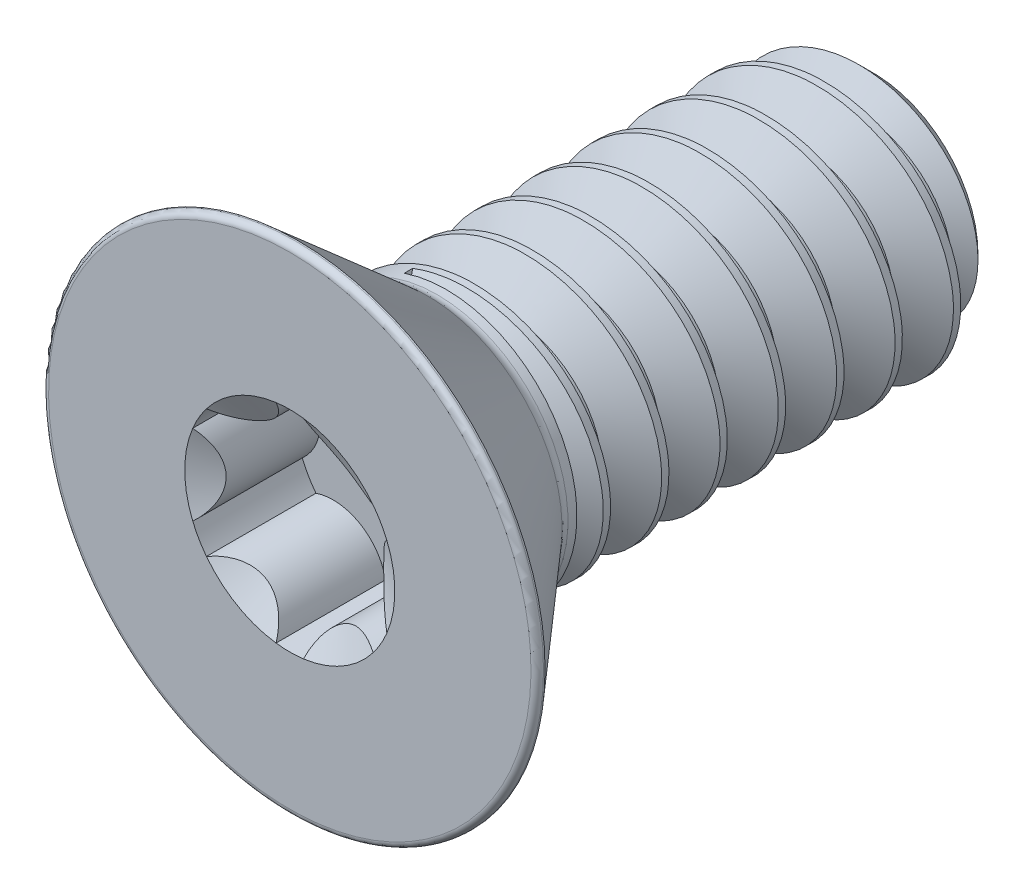
from build123d import *

# Parameters (mm, degrees)
CHAMFER1_SIZE      = 0.28448
CUT_EXTRUDE2_DEPTH = 1.19126
CIRPATTERN1_COUNT  = 6
FILLET1_R          = 0.068072
FILLET2_R          = 0.155742123
CUT_SWEEP2_PITCH   = 0.635


with BuildPart() as part:
    # Sketch12 → Revolve3 (revolve)
    with BuildSketch(Plane(origin=(0, 0, 0), x_dir=(0, 0, -1), z_dir=(1, 0, 0)), mode=Mode.PRIVATE) as revolve3_sk:
        Polygon((-3.175, 0), (3.175, 0), (3.175, 1.4224), (-1.628942123, 1.4224), (-3.08991, 2.6924), (-3.175, 2.6924), align=None)
    revolve(revolve3_sk.sketch.rotate(Axis((0, 0, 3.175), (0, 0, -1)), 180), axis=Axis((0, 0, 3.175), (0, 0, -1)))

    # Chamfer1
    chamfer1_edges = [part.edges().sort_by_distance(p)[0] for p in [
        (0, 1.4224, -3.175),
    ]]
    chamfer(chamfer1_edges, length=CHAMFER1_SIZE)

    # Sketch5 → Cut-Extrude2 (cut)
    with BuildSketch(Plane.XY.offset(3.175)):
        with BuildLine():
            Line((-0.989867037, -0.5715), (0, 0))
            Line((0, 0), (-0.989867037, 0.5715))
            ThreePointArc((-0.989867037, 0.5715), (-1.025125544, 0.505535973), (-1.055994306, 0.437407163))
            ThreePointArc((-1.055994306, 0.437407163), (-0.85725, 0), (-1.055994306, -0.437407163))
            ThreePointArc((-1.055994306, -0.437407163), (-1.025125544, -0.505535973), (-0.989867037, -0.5715))
        make_face()
    cut_extrude2 = extrude(amount=-CUT_EXTRUDE2_DEPTH, mode=Mode.SUBTRACT)

    # CirPattern1: Cut-Extrude2 ×6 about axis
    cirpattern1_axis = Axis((0, 0, 0), (0, 0, 1))
    for i in range(1, CIRPATTERN1_COUNT):
        add(cut_extrude2.rotate(cirpattern1_axis, i * 360 / CIRPATTERN1_COUNT), mode=Mode.SUBTRACT)

    # Cut-Extrude3 cone 1 section (through the dimple's axis) → Cut-Extrude3 (revolve, cut)
    with BuildSketch(Plane(origin=(0, 0, 3.175), x_dir=(0, -1, 0), z_dir=(1, 0, 0))):
        Polygon((0, 0), (1.143, 0), (0, 0.659911358), align=None)
    revolve(axis=Axis((0, 0, 3.175), (0, 0, -1)), mode=Mode.SUBTRACT)

    # Fillet1
    fillet1_edges = [part.edges().sort_by_distance(p)[0] for p in [
        (0, 2.6924, 3.175),
    ]]
    fillet(fillet1_edges, radius=FILLET1_R)

    # Fillet2
    fillet2_edges = [part.edges().sort_by_distance(p)[0] for p in [
        (0, 1.4224, 1.628942123),
    ]]
    fillet(fillet2_edges, radius=FILLET2_R)


with BuildPart() as body_2:
    # Split1: the piece on the far side of the plane
    add(part.part)
    split(bisect_by=Plane.XY.offset(1.4732), keep=Keep.BOTTOM)

    # Cut-Sweep2: the profile of Sketch14 screwed along a right-hand helix of 8.052 turns, 6 arcs to a turn; built about Z, then put on its axis
    cut_sweep2_z = Axis((0, 0, 0), (0, 0, 1))
    cut_sweep2_corners = [(1.009955401, 0, -0.238125), (1.009955401, 0, -0.3175), (1.456770383, 0, -0.57546875), (1.456770383, 0, 0.01984375)]
    with BuildLine(mode=Mode.PRIVATE) as cut_sweep2_profile:
        Line(cut_sweep2_corners[0], cut_sweep2_corners[1])
        Line(cut_sweep2_corners[1], cut_sweep2_corners[2])
        Line(cut_sweep2_corners[2], cut_sweep2_corners[3])
        Line(cut_sweep2_corners[3], cut_sweep2_corners[0])
    cut_sweep2_cap = Face(cut_sweep2_profile.wire())
    cut_sweep2_turn_angles = [0, 30, 60, 90, 120, 150, 180, 210, 240, 270, 300, 330, 360]
    cut_sweep2_turn_weights = [1, 0.8660254037844387, 1, 0.8660254037844387, 1, 0.8660254037844387, 1, 0.8660254037844387, 1, 0.8660254037844387, 1, 0.8660254037844387, 1]
    cut_sweep2_turn_rails = [Edge.make_bspline([Vector(p[0], p[1], 0).rotate(cut_sweep2_z, cut_sweep2_turn_angles[k]) / cut_sweep2_turn_weights[k] + Vector(0, 0, p[2] + CUT_SWEEP2_PITCH * cut_sweep2_turn_angles[k] / 360) for k in range(13)], [0, 0, 0, 1, 1, 2, 2, 3, 3, 4, 4, 5, 5, 6, 6, 6], 2, cut_sweep2_turn_weights) for p in cut_sweep2_corners]
    cut_sweep2_turn_sides = [Face.make_surface_from_curves(cut_sweep2_turn_rails[p[0]], cut_sweep2_turn_rails[p[1]]) for p in [(0, 1), (1, 2), (2, 3), (3, 0)]]
    cut_sweep2_turn = Solid(Shell([*cut_sweep2_turn_sides, cut_sweep2_cap, cut_sweep2_cap.rotate(cut_sweep2_z, 360).moved(Location((0, 0, CUT_SWEEP2_PITCH * 360 / 360)))]))
    cut_sweep2_last_angles = [2880, 2889.36, 2898.72]
    cut_sweep2_last_weights = [1, 0.9866859442078684, 1]
    cut_sweep2_last_rails = [Edge.make_bspline([Vector(p[0], p[1], 0).rotate(cut_sweep2_z, cut_sweep2_last_angles[k]) / cut_sweep2_last_weights[k] + Vector(0, 0, p[2] + CUT_SWEEP2_PITCH * cut_sweep2_last_angles[k] / 360) for k in range(3)], [0, 0, 0, 1, 1, 1], 2, cut_sweep2_last_weights) for p in cut_sweep2_corners]
    cut_sweep2_last_sides = [Face.make_surface_from_curves(cut_sweep2_last_rails[p[0]], cut_sweep2_last_rails[p[1]]) for p in [(0, 1), (1, 2), (2, 3), (3, 0)]]
    cut_sweep2_last = Solid(Shell([*cut_sweep2_last_sides, cut_sweep2_cap.rotate(cut_sweep2_z, 2880).moved(Location((0, 0, CUT_SWEEP2_PITCH * 2880 / 360))), cut_sweep2_cap.rotate(cut_sweep2_z, 2898.72).moved(Location((0, 0, CUT_SWEEP2_PITCH * 2898.72 / 360)))]))
    cut_sweep2_each = [*[cut_sweep2_turn.moved(Location((0, 0, CUT_SWEEP2_PITCH * i))) for i in range(8)], cut_sweep2_last]
    add(Plane(origin=(0, 0, -3.175), x_dir=(0, 1, 0), z_dir=(0, 0, 1)) * Compound([cut_sweep2_each[i] for i in range(0, 9, 2)]), mode=Mode.SUBTRACT)
    add(Plane(origin=(0, 0, -3.175), x_dir=(0, 1, 0), z_dir=(0, 0, 1)) * Compound([cut_sweep2_each[i] for i in range(1, 9, 2)]), mode=Mode.SUBTRACT)


with BuildPart() as part_1:
    add(part.part)

    # Split1
    split(bisect_by=Plane.XY.offset(1.4732), keep=Keep.TOP)

    add(body_2.part)  # Boss-Extrude1 merges body 2
    # Boss-Extrude1 cone 1 section (through the dimple's axis) → Boss-Extrude1 (revolve)
    with BuildSketch(Plane(origin=(0, 0, 1.4732), x_dir=(0, -1, 0), z_dir=(1, 0, 0))):
        Polygon((0, 0), (1.4224, 0), (0, 0.821223023), align=None)
    revolve(axis=Axis((0, 0, 1.4732), (0, 0, -1)))


solid = part_1.part
